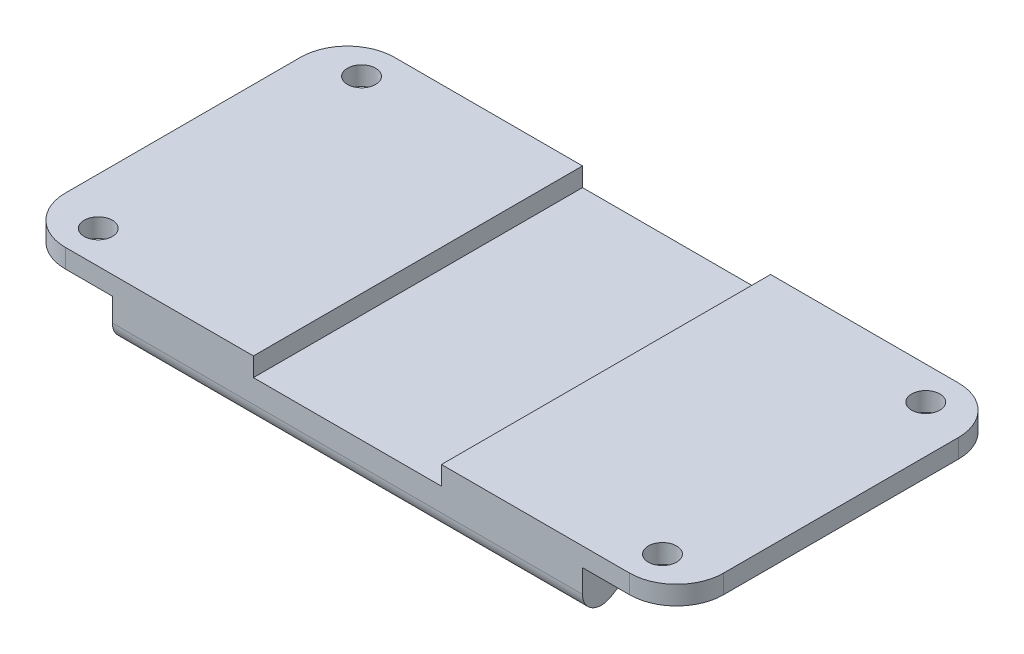
from build123d import *

# Parameters (mm, degrees)
SKETCH1_W               = 50
SKETCH1_H               = 35
BOSS_EXTRUDE1_DEPTH     = 8
CUT_EXTRUDE1_DEPTH      = 54.574714185
CUT_EXTRUDE1_DEPTH_BACK = 54.574714185
FILLET1_R               = 2
SKETCH5_W               = 35
SKETCH5_H               = 2
BOSS_EXTRUDE2_DEPTH     = 10
SKETCH6_R               = 1.5
CUT_EXTRUDE2_DEPTH      = 10
SKETCH3_W               = 20
SKETCH3_H               = 2
CUT_EXTRUDE3_DEPTH      = 50.91823413
FILLET3_R               = 5


with BuildPart() as part:
    # Sketch1 → Boss-Extrude1 (new body)
    with BuildSketch(Plane(origin=(0, 0, 0), x_dir=(1, 0, 0), z_dir=(0, 1, 0))):
        Rectangle(SKETCH1_W, SKETCH1_H)
    extrude(amount=-BOSS_EXTRUDE1_DEPTH)

    # Sketch2 → Cut-Extrude1 (cut, two sides: drawn at the far end of the back side and taken through both)
    with BuildSketch(Plane(origin=(25, 0, 0), x_dir=(0, 0, -1), z_dir=(1, 0, 0)).offset(-CUT_EXTRUDE1_DEPTH_BACK)):
        Polygon((-12.5, -5), (-17.5, -8), (17.5, -8), (12.5, -5), align=None)
    extrude(amount=CUT_EXTRUDE1_DEPTH + CUT_EXTRUDE1_DEPTH_BACK, mode=Mode.SUBTRACT)

    # Fillet1
    fillet1_edges = [part.edges().sort_by_distance(p)[0] for p in [
        (0, -5, 12.5),
        (0, -5, -12.5),
        (0, -8, -17.5),
        (0, -8, 17.5),
    ]]
    fillet(fillet1_edges, radius=FILLET1_R)

    # Sketch5 → Boss-Extrude2 (add)
    with BuildSketch(Plane.ZY.offset(25)):
        with Locations((0, -1)):
            Rectangle(SKETCH5_W, SKETCH5_H)
    boss_extrude2 = extrude(amount=BOSS_EXTRUDE2_DEPTH)

    # Mirror1: Boss-Extrude2 across plane
    add(boss_extrude2.mirror(Plane(origin=(0, 0, 0), x_dir=(0, 0, 1), z_dir=(1, 0, 0))))

    # Sketch6 → Cut-Extrude2 (cut)
    with BuildSketch(Plane(origin=(0, 0, 0), x_dir=(1, 0, 0), z_dir=(0, 1, 0))):
        with Locations((-30, 14)):
            Circle(SKETCH6_R)
        with Locations((-30, -14)):
            Circle(SKETCH6_R)
        with Locations((30, -14)):
            Circle(SKETCH6_R)
        with Locations((30, 14)):
            Circle(SKETCH6_R)
    extrude(amount=-CUT_EXTRUDE2_DEPTH, mode=Mode.SUBTRACT)

    # Sketch3 → Cut-Extrude3 (cut, through all)
    with BuildSketch(Plane.XY.offset(17.5)):
        with Locations((0, -1)):
            Rectangle(SKETCH3_W, SKETCH3_H)
    extrude(amount=-CUT_EXTRUDE3_DEPTH, mode=Mode.SUBTRACT)

    # Fillet3
    fillet3_edges = [part.edges().sort_by_distance(p)[0] for p in [
        (35, -1, 17.5),
        (35, -1, -17.5),
        (-35, -1, -17.5),
        (-35, -1, 17.5),
    ]]
    fillet(fillet3_edges, radius=FILLET3_R)


solid = part.part
